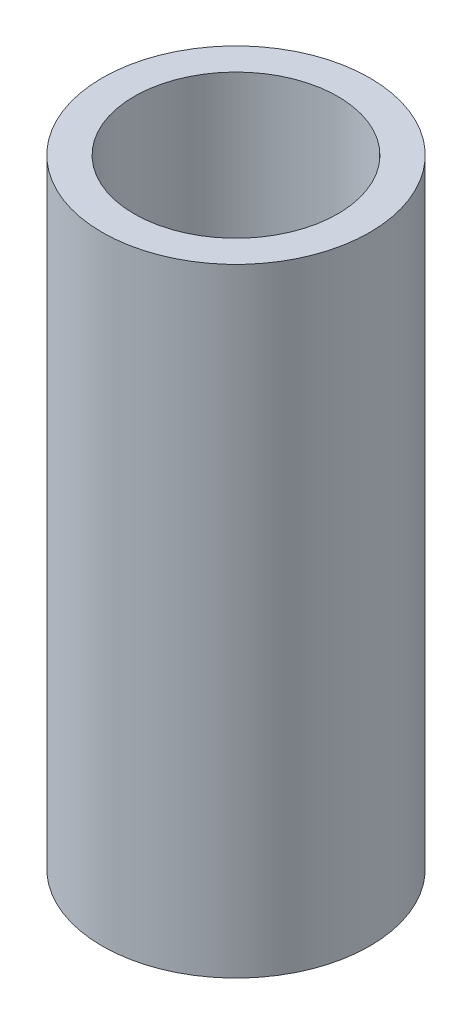
from build123d import *

# Parameters (mm, degrees)
SKETCH1_R           = 12.5
BOSS_EXTRUDE1_DEPTH = 57.737586065
SKETCH2_R           = 9.509571724
CUT_EXTRUDE1_DEPTH  = 61.383183458


with BuildPart() as part:
    # Sketch1 → Boss-Extrude1 (new body)
    with BuildSketch(Plane(origin=(0, 0, 0), x_dir=(1, 0, 0), z_dir=(0, 1, 0))):
        Circle(SKETCH1_R)
    extrude(amount=BOSS_EXTRUDE1_DEPTH)

    # Sketch2 → Cut-Extrude1 (cut, through all)
    with BuildSketch(Plane(origin=(0, 0, 0), x_dir=(1, 0, 0), z_dir=(0, 1, 0))):
        Circle(SKETCH2_R)
    extrude(amount=CUT_EXTRUDE1_DEPTH, mode=Mode.SUBTRACT)


solid = part.part
